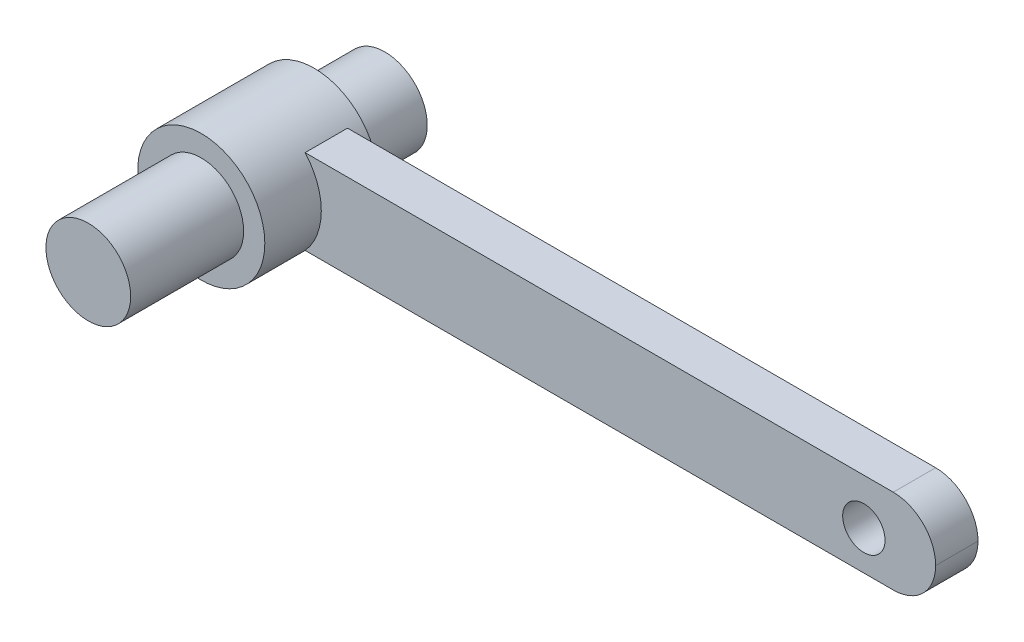
from build123d import *

# Parameters (mm, degrees)
SKETCH_1_R           = 0.45
SKETCH_1_R_2         = 0.3
EXTRUDE_1_DEPTH      = 0.8
SKETCH_3_W           = 0.3
SKETCH_3_H           = 0.6
EXTRUDE_4_DEPTH      = 4.5
SKETCH_7_R           = 0.15
CUT_EXTRUDE_3_DEPTH  = 4.5
FILLET_1_R           = 0.3
EXTRUDE_5_DEPTH      = 0.8
EXTRUDE_5_DEPTH_BACK = 1.3
SKETCH_8_R           = 0.3


with BuildPart() as part:
    # 草图1 → 凸台-拉伸1 (new body)
    with BuildSketch(Plane.XY):
        with Locations((-10.5, -0.5)):
            Circle(SKETCH_1_R)
        with Locations((-10.5, -0.5)):
            Circle(SKETCH_1_R_2, mode=Mode.SUBTRACT)
    extrude(amount=EXTRUDE_1_DEPTH)

    # 草图3 → 凸台-拉伸4 (add)
    with BuildSketch(Plane(origin=(-10.2, -0.5, 0.8), x_dir=(0, 0, -1), z_dir=(1, 0, 0))):
        with Locations((0.55, 0)):
            Rectangle(SKETCH_3_W, SKETCH_3_H)
    extrude(amount=EXTRUDE_4_DEPTH)

    # 草图7 → 切除-拉伸3 (cut)
    with BuildSketch(Plane.XY.offset(0.4)):
        with Locations((-6.208225563, -0.524292894)):
            Circle(SKETCH_7_R)
    extrude(amount=-CUT_EXTRUDE_3_DEPTH, mode=Mode.SUBTRACT)

    # 圆角1
    fillet_1_edges = [part.edges().sort_by_distance(p)[0] for p in [
        (-5.7, -0.8, 0.25),
        (-5.7, -0.2, 0.25),
    ]]
    fillet(fillet_1_edges, radius=FILLET_1_R - 0.0001)  # a hair under: the kernel refuses the full size

    # 草图8 → 凸台-拉伸5 (add, two sides: drawn at the far end of the back side and taken through both)
    with BuildSketch(Plane.XY.offset(0.8).offset(-EXTRUDE_5_DEPTH_BACK)):
        with Locations((-10.5, -0.5)):
            Circle(SKETCH_8_R)
    extrude(amount=EXTRUDE_5_DEPTH + EXTRUDE_5_DEPTH_BACK)


solid = part.part
